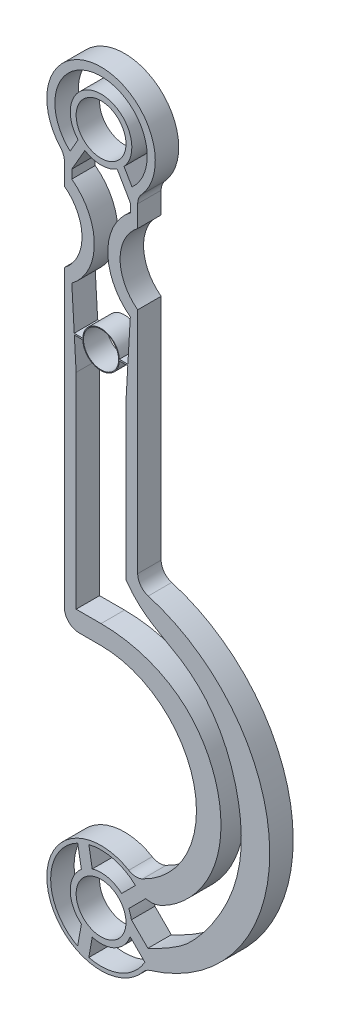
from build123d import *

# Parameters (mm, degrees)
BOSS_EXTRUDE1_OUTLINE_R   = 8.5
BOSS_EXTRUDE1_OUTLINE_R_2 = 6
BOSS_EXTRUDE1_DEPTH       = 8
FILLET1_R                 = 5


# Read off the part's stored shape, not the designer's step: Boss-Extrude1
with BuildPart() as part:
    # Boss-Extrude1 outline → Boss-Extrude1 (new body)
    with BuildSketch(Plane.XY):
        with BuildLine():
            ThreePointArc((11.444366088, -215.464647068), (-18.29086587, -232.773846738), (15.239317045, -240.488718511))
            ThreePointArc((15.239317045, -240.488718511), (57.52601951, -183.58870793), (12.5, -128.830749818))
            Line((12.5, -128.830749818), (12.5, -47))
            ThreePointArc((12.5, -47), (6.5, -35), (12.5, -23))
            Line((12.5, -23), (12.5, -13.638181697))
            ThreePointArc((12.5, -13.638181697), (0, 18.5), (-12.5, -13.638181697))
            Line((-12.5, -13.638181697), (-12.5, -23))
            ThreePointArc((-12.5, -23), (-6.5, -35), (-12.5, -47))
            Line((-12.5, -47), (-12.5, -152.456671403))
            Line((-12.5, -152.456671403), (0, -152.456671403))
            ThreePointArc((0, -152.456671403), (32.019441409, -179.184193262), (11.444366088, -215.464647068))
        make_face()
        with BuildLine():
            Line((-7.973490155, -214.766711736), (-6.711318898, -221.924840642))
            ThreePointArc((-6.711318898, -221.924840642), (-10.5, -230), (-6.711318898, -238.075159358))
            Line((-6.711318898, -238.075159358), (-7.973490155, -245.233288264))
            ThreePointArc((-7.973490155, -245.233288264), (-17.193883115, -230), (-7.973490155, -214.766711736))
        make_face(mode=Mode.SUBTRACT)
        with Locations((0, -230)):
            Circle(BOSS_EXTRUDE1_OUTLINE_R, mode=Mode.SUBTRACT)
        with BuildLine():
            Line((9.906951591, -233.478837475), (14.939441722, -238.511327606))
            ThreePointArc((14.939441722, -238.511327606), (6.76001668, -245.809231198), (-4.167102507, -246.681273131))
            Line((-4.167102507, -246.681273131), (-3, -240.062305899))
            ThreePointArc((-3, -240.062305899), (4.770954746, -239.353501527), (9.906951591, -233.478837475))
        make_face(mode=Mode.SUBTRACT)
        with BuildLine():
            ThreePointArc((-4.167102507, -213.318726869), (4.313198594, -213.355903915), (11.744241411, -217.442037973))
            Line((11.744241411, -217.442037973), (7.006604785, -222.179674599))
            ThreePointArc((7.006604785, -222.179674599), (2.295613124, -219.754017354), (-3, -219.937694101))
            Line((-3, -219.937694101), (-4.167102507, -213.318726869))
        make_face(mode=Mode.SUBTRACT)
        with BuildLine():
            Line((-9.120514821, -65.25), (-6.244997998, -65.25))
            ThreePointArc((-6.244997998, -65.25), (0, -71.25), (6.244997998, -65.25))
            Line((6.244997998, -65.25), (9.120514821, -65.25))
            Line((9.120514821, -65.25), (8.5, -76))
            Line((8.5, -76), (8.5, -128.830749818))
            add(Edge.make_bspline(
                [(8.5, -128.830749818), (14.216428999, -136.925995784), (24.412916063, -140.031339282), (39.034077584, -152.550131118), (47.231822633, -170.300911516), (49.054269576, -194.272422538), (41.074598095, -212.224255349), (31.066489276, -224.744159717), (25.719963337, -228.85152204), (16.869060862, -233.660143999), (17.031893097, -233.444420703), (15.977956611, -233.892988246)],
                knots=[0, 0, 0, 0, 0.166174086, 0.244582813, 0.412844745, 0.582307016, 0.755175806, 0.839944941, 0.911400458, 0.950609874, 0.975595454, 0.975595454, 0.975595454, 0.975595454], degree=3))
            Line((15.977956611, -233.892988246), (10.356807409, -228.271839044))
            ThreePointArc((10.356807409, -228.271839044), (10.001893352, -226.804357751), (9.440185923, -225.402947711))
            Line((9.440185923, -225.402947711), (15.293943971, -219.549189663))
            add(Edge.make_bspline(
                [(0, -145.95306611), (10.568996212, -145.925278871), (27.155310415, -151.118043437), (40.058908168, -171.037832184), (42.279362691, -190.702442643), (34.923587781, -208.161141567), (23.812379339, -217.919127216), (17.682972603, -220.190054159), (15.293943971, -219.549189663)],
                knots=[0, 0, 0, 0, 0.275280109, 0.420961818, 0.610903185, 0.776926109, 0.912853108, 0.974522095, 0.974522095, 0.974522095, 0.974522095], degree=3))
            Line((0, -145.95306611), (-8.5, -145.95306611))
            Line((-8.5, -145.95306611), (-8.5, -76))
            Line((-8.5, -76), (-9.120514821, -65.25))
        make_face(mode=Mode.SUBTRACT)
        with Locations((0, -65)):
            Circle(BOSS_EXTRUDE1_OUTLINE_R_2, mode=Mode.SUBTRACT)
        with BuildLine():
            Line((-9.98, -16.684502452), (-5.508245457, -8.939196384))
            ThreePointArc((-5.508245457, -8.939196384), (0, -10.5), (5.508245457, -8.939196384))
            Line((5.508245457, -8.939196384), (9.98, -16.684502452))
            Line((9.98, -16.684502452), (9.98, -19.64))
            ThreePointArc((9.98, -19.64), (2.3, -35), (9.98, -50.36))
            Line((9.98, -50.36), (9.149375975, -64.75))
            Line((9.149375975, -64.75), (6.244997998, -64.75))
            ThreePointArc((6.244997998, -64.75), (0, -58.75), (-6.244997998, -64.75))
            Line((-6.244997998, -64.75), (-9.149375975, -64.75))
            Line((-9.149375975, -64.75), (-9.98, -50.36))
            ThreePointArc((-9.98, -50.36), (-2.3, -35), (-9.98, -19.64))
            Line((-9.98, -19.64), (-9.98, -16.684502452))
        make_face(mode=Mode.SUBTRACT)
        Circle(BOSS_EXTRUDE1_OUTLINE_R, mode=Mode.SUBTRACT)
        with BuildLine():
            ThreePointArc((7.842336088, -6.981959946), (0, 10.5), (-7.842336088, -6.981959946))
            Line((-7.842336088, -6.981959946), (-10.558604534, -11.686674903))
            ThreePointArc((-10.558604534, -11.686674903), (0, 15.75), (10.558604534, -11.686674903))
            Line((10.558604534, -11.686674903), (7.842336088, -6.981959946))
        make_face(mode=Mode.SUBTRACT)
    extrude(amount=BOSS_EXTRUDE1_DEPTH)

    # Fillet1
    fillet1_edges = [part.edges().sort_by_distance(p)[0] for p in [
        (11.444366088, -215.464647068, 4),
        (-12.5, -152.456671403, 4),
        (-12.5, -13.638181697, 4),
        (12.5, -13.638181697, 4),
        (12.5, -128.830749818, 4),
        (15.239317045, -240.488718511, 4),
    ]]
    fillet(fillet1_edges, radius=FILLET1_R)


solid = part.part
